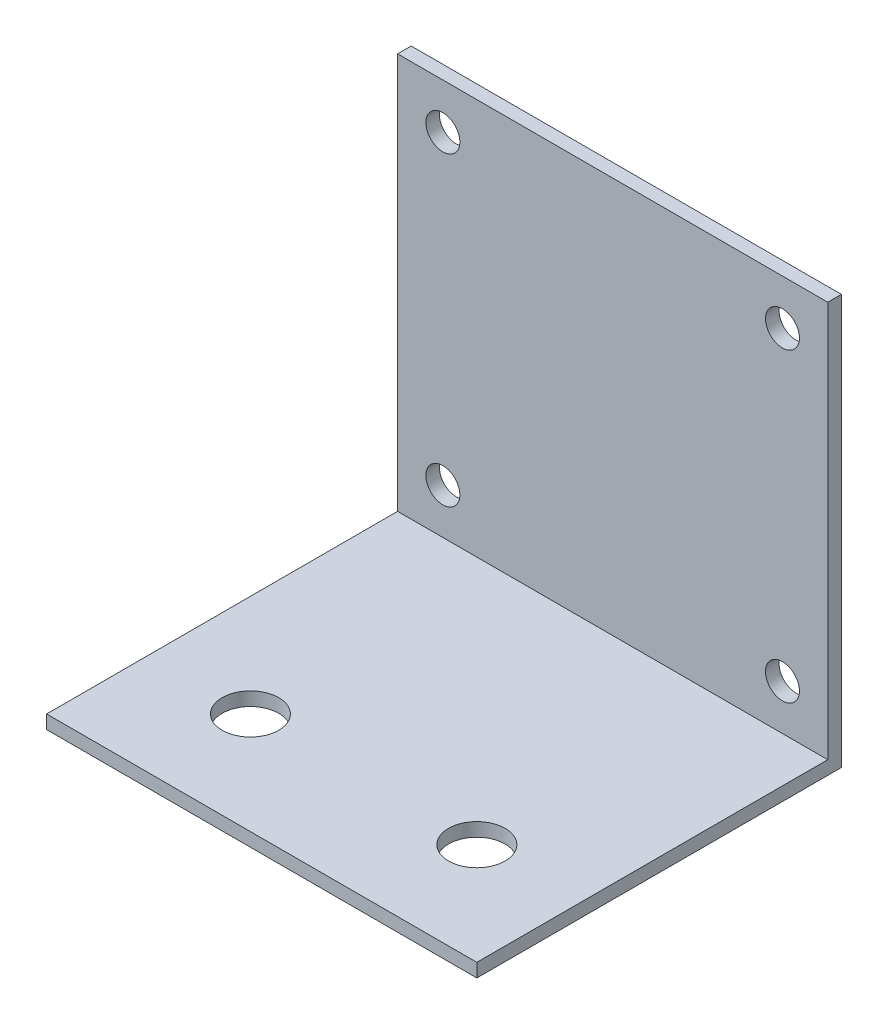
from build123d import *

# Parameters (mm, degrees)
SKETCH1_W           = 38
SKETCH1_H           = 32.2
SKETCH1_R           = 2.5
BOSS_EXTRUDE1_DEPTH = 1.2
SKETCH2_W           = 38
SKETCH2_H           = 1.2
BOSS_EXTRUDE2_DEPTH = 35
SKETCH3_R           = 1.5
CUT_EXTRUDE1_DEPTH  = 61.954409192


with BuildPart() as part:
    # Sketch1 → Boss-Extrude1 (new body)
    with BuildSketch(Plane(origin=(0, 0, 0), x_dir=(1, 0, 0), z_dir=(0, 1, 0))):
        with Locations((-19, -16.1)):
            Rectangle(SKETCH1_W, SKETCH1_H)
        with Locations((-29, -23.2)):
            Circle(SKETCH1_R, mode=Mode.SUBTRACT)
        with Locations((-9, -23.2)):
            Circle(SKETCH1_R, mode=Mode.SUBTRACT)
    extrude(amount=BOSS_EXTRUDE1_DEPTH)

    # Sketch2 → Boss-Extrude2 (add)
    with BuildSketch(Plane(origin=(0, 1.2, 0), x_dir=(1, 0, 0), z_dir=(0, 1, 0))):
        with Locations((-19, -0.6)):
            Rectangle(SKETCH2_W, SKETCH2_H)
    extrude(amount=BOSS_EXTRUDE2_DEPTH)

    # Sketch3 → Cut-Extrude1 (cut, through all)
    with BuildSketch(Plane.XY.offset(1.2)):
        with Locations((-34, 5.2)):
            Circle(SKETCH3_R)
        with Locations((-34, 32.2)):
            Circle(SKETCH3_R)
        with Locations((-4, 5.2)):
            Circle(SKETCH3_R)
        with Locations((-4, 32.2)):
            Circle(SKETCH3_R)
    extrude(amount=-CUT_EXTRUDE1_DEPTH, mode=Mode.SUBTRACT)


solid = part.part
